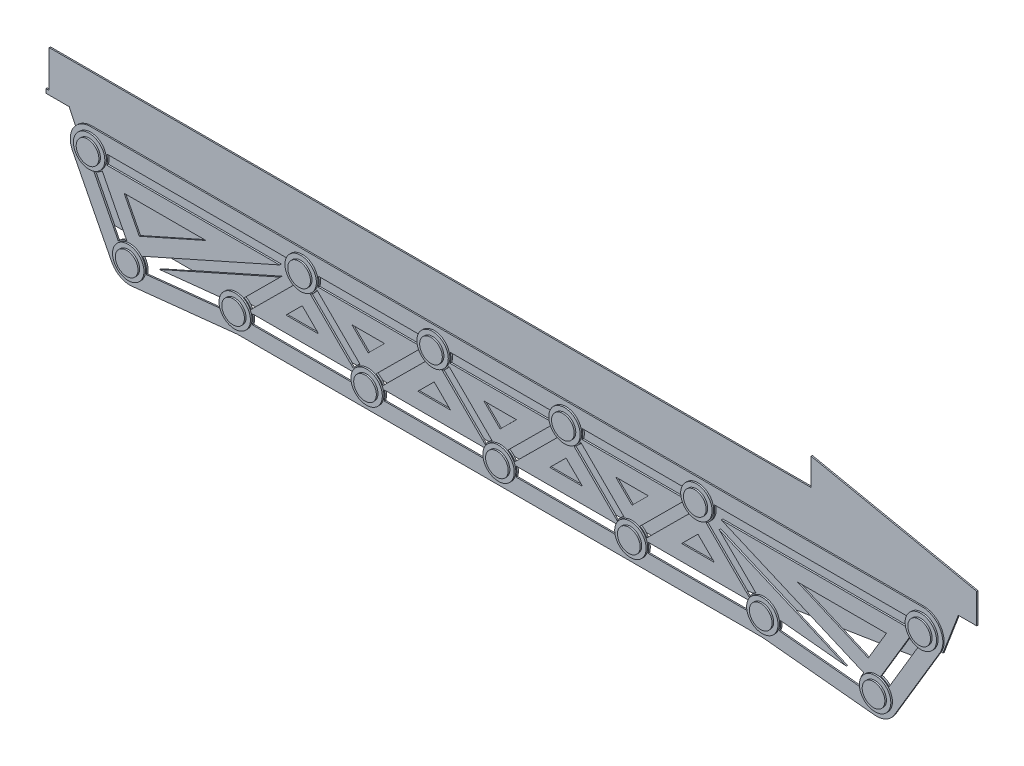
from build123d import *

# Parameters (mm, degrees)
BOSS_EXTRUDE1_DEPTH     = 2
CUT_EXTRUDE1_DEPTH      = 95
BOSS_EXTRUDE2_DEPTH     = 2
SKETCH8_R               = 24.537448368
SKETCH8_R_2             = 17.7
BOSS_EXTRUDE3_DEPTH     = 2.5
SKETCH10_R              = 17.7
BOSS_EXTRUDE4_DEPTH     = 5
CUT_EXTRUDE_THIN1_START = -2.5
CUT_EXTRUDE_THIN1_DEPTH = 2.5
SKETCH13_R              = 26.082644492
BOSS_EXTRUDE7_DEPTH     = 2.5


# Read off the part's stored shape, not the designer's step: Cut-Extrude-Thin1
with BuildPart() as part:
    # Sketch1 → Boss-Extrude1 (new body)
    with BuildSketch(Plane.XY):
        Polygon((-736.648701218, 88.883015108), (453.41882074, 88.883015108), (453.41882074, 173.482456742), (711.95348608, 124.467176144), (711.95348608, 30.993499664), (683.208977835, 30.993499664), (659.264020192, -32.002513419), (641.952563774, -32.002513419), (632.634396759, -56.517377047), (353.590702351, -101.164368152), (-642.977873177, -101.164368152), (-674.853268885, -32.002513419), (-679.263572152, -32.002513419), (-705.332399808, 24.560501137), (-741.648701218, 24.560501137), (-741.648701218, 30.993499664), (-736.648701218, 30.993499664), align=None)
    extrude(amount=BOSS_EXTRUDE1_DEPTH)

    # Sketch4 → Cut-Extrude1 (cut)
    with BuildSketch(Plane.XY.offset(2)):
        Polygon((453.41882074, 131.182735925), (711.95348608, 77.730337904), (711.95348608, 124.467176144), (453.41882074, 173.482456742), align=None)
    extrude(amount=-CUT_EXTRUDE1_DEPTH, mode=Mode.SUBTRACT)

    # Sketch7 → Boss-Extrude2 (add)
    with BuildSketch(Plane.XY.offset(2)):
        with BuildLine():
            Line((-698.284481822, -30.128109135), (-637.164888543, -150.007726386))
            ThreePointArc((-637.164888543, -150.007726386), (-623.935322202, -163.580236507), (-605.344607638, -167.270736277))
            Line((-605.344607638, -167.270736277), (-440.725267433, -149.897212351))
            Line((-440.725267433, -149.897212351), (380.005637956, -149.897212351))
            Line((380.005637956, -149.897212351), (554.595690688, -167.289830618))
            ThreePointArc((554.595690688, -167.289830618), (572.156705191, -164.021740444), (585.219602483, -151.838540615))
            Line((585.219602483, -151.838540615), (656.581665828, -31.958923364))
            ThreePointArc((656.581665828, -31.958923364), (656.903283945, 0.17688449), (629.125222909, 16.338348214))
            Line((629.125222909, 16.338348214), (-669.81781481, 16.338348214))
            ThreePointArc((-669.81781481, 16.338348214), (-697.064295268, 1.077341701), (-698.284481822, -30.128109135))
        make_face()
        Polygon((-617.660623592, -47.5675951), (-594.00016655, -93.975078886), (-489.752744141, -47.5675951), align=None, mode=Mode.SUBTRACT)
        Polygon((-364.907828833, -85.991269037), (-313.905606566, -85.991269037), (-339.4067177, -60.65613368), align=None, mode=Mode.SUBTRACT)
        Polygon((572.91832989, -47.5675951), (433.984814975, -47.5675951), (544.633939386, -95.081943043), align=None, mode=Mode.SUBTRACT)
        Polygon((-236.4067177, -72.902730457), (-210.905606566, -47.5675951), (-261.907828833, -47.5675951), align=None, mode=Mode.SUBTRACT)
        Polygon((-158.907828833, -85.991269037), (-133.4067177, -60.65613368), (-107.905606566, -85.991269037), align=None, mode=Mode.SUBTRACT)
        Polygon((72.5932823, -60.65613368), (98.094393434, -85.991269037), (47.092171167, -85.991269037), align=None, mode=Mode.SUBTRACT)
        Polygon((-55.907828833, -47.5675951), (-30.4067177, -72.902730457), (-4.905606566, -47.5675951), align=None, mode=Mode.SUBTRACT)
        Polygon((201.094393434, -47.5675951), (150.092171167, -47.5675951), (175.5932823, -72.902730457), align=None, mode=Mode.SUBTRACT)
        Polygon((253.092171167, -85.991269037), (278.5932823, -60.65613368), (304.094393434, -85.991269037), align=None, mode=Mode.SUBTRACT)
    extrude(amount=BOSS_EXTRUDE2_DEPTH)

    # Sketch8 → Boss-Extrude3 (add)
    # profile 1 of 13: a face of its own
    with BuildSketch(Plane.XY.offset(4)):
        with Locations((-669.81781481, -15.614623443)):
            Circle(SKETCH8_R)
        with Locations((-669.81781481, -15.614623443)):
            Circle(SKETCH8_R_2, mode=Mode.SUBTRACT)
    # profile 2 of 13: a face of its own
    with BuildSketch(Plane.XY.offset(4)):
        with Locations((-339.4067177, -15.614623443)):
            Circle(SKETCH8_R)
        with Locations((-339.4067177, -15.614623443)):
            Circle(SKETCH8_R_2, mode=Mode.SUBTRACT)
    # profile 3 of 13: a face of its own
    with BuildSketch(Plane.XY.offset(4)):
        with Locations((-133.4067177, -15.614623443)):
            Circle(SKETCH8_R)
        with Locations((-133.4067177, -15.614623443)):
            Circle(SKETCH8_R_2, mode=Mode.SUBTRACT)
    # profile 4 of 13: a face of its own
    with BuildSketch(Plane.XY.offset(4)):
        with Locations((72.5932823, -15.614623443)):
            Circle(SKETCH8_R)
        with Locations((72.5932823, -15.614623443)):
            Circle(SKETCH8_R_2, mode=Mode.SUBTRACT)
    # profile 5 of 13: a face of its own
    with BuildSketch(Plane.XY.offset(4)):
        with Locations((278.5932823, -15.614623443)):
            Circle(SKETCH8_R)
        with Locations((278.5932823, -15.614623443)):
            Circle(SKETCH8_R_2, mode=Mode.SUBTRACT)
    # profile 6 of 13: a face of its own
    with BuildSketch(Plane.XY.offset(4)):
        with Locations((381.5932823, -117.944240694)):
            Circle(SKETCH8_R)
        with Locations((381.5932823, -117.944240694)):
            Circle(SKETCH8_R_2, mode=Mode.SUBTRACT)
    # profile 7 of 13: a face of its own
    with BuildSketch(Plane.XY.offset(4)):
        with Locations((557.763159564, -135.494240694)):
            Circle(SKETCH8_R)
        with Locations((557.763159564, -135.494240694)):
            Circle(SKETCH8_R_2, mode=Mode.SUBTRACT)
    # profile 8 of 13: a face of its own
    with BuildSketch(Plane.XY.offset(4)):
        with Locations((629.125222909, -15.614623443)):
            Circle(SKETCH8_R)
        with Locations((629.125222909, -15.614623443)):
            Circle(SKETCH8_R_2, mode=Mode.SUBTRACT)
    # profile 9 of 13: a face of its own
    with BuildSketch(Plane.XY.offset(4)):
        with Locations((175.5932823, -117.944240694)):
            Circle(SKETCH8_R)
        with Locations((175.5932823, -117.944240694)):
            Circle(SKETCH8_R_2, mode=Mode.SUBTRACT)
    # profile 10 of 13: a face of its own
    with BuildSketch(Plane.XY.offset(4)):
        with Locations((-30.4067177, -117.944240694)):
            Circle(SKETCH8_R)
        with Locations((-30.4067177, -117.944240694)):
            Circle(SKETCH8_R_2, mode=Mode.SUBTRACT)
    # profile 11 of 13: a face of its own
    with BuildSketch(Plane.XY.offset(4)):
        with Locations((-236.4067177, -117.944240694)):
            Circle(SKETCH8_R)
        with Locations((-236.4067177, -117.944240694)):
            Circle(SKETCH8_R_2, mode=Mode.SUBTRACT)
    # profile 12 of 13: a face of its own
    with BuildSketch(Plane.XY.offset(4)):
        with Locations((-442.4067177, -117.944240694)):
            Circle(SKETCH8_R)
        with Locations((-442.4067177, -117.944240694)):
            Circle(SKETCH8_R_2, mode=Mode.SUBTRACT)
    # profile 13 of 13: a face of its own
    with BuildSketch(Plane.XY.offset(4)):
        with Locations((-608.698221531, -135.494240694)):
            Circle(SKETCH8_R)
        with Locations((-608.698221531, -135.494240694)):
            Circle(SKETCH8_R_2, mode=Mode.SUBTRACT)
    extrude(amount=BOSS_EXTRUDE3_DEPTH)

    # Sketch10 → Boss-Extrude4 (add)
    with BuildSketch(Plane.XY.offset(4)):
        with Locations((-669.81781481, -15.614623443)):
            Circle(SKETCH10_R)
        with Locations((-339.4067177, -15.614623443)):
            Circle(SKETCH10_R)
        with Locations((-133.4067177, -15.614623443)):
            Circle(SKETCH10_R)
        with Locations((72.5932823, -15.614623443)):
            Circle(SKETCH10_R)
        with Locations((278.5932823, -15.614623443)):
            Circle(SKETCH10_R)
        with Locations((629.125222909, -15.614623443)):
            Circle(SKETCH10_R)
        with Locations((557.763159564, -135.494240694)):
            Circle(SKETCH10_R)
        with Locations((381.5932823, -117.944240694)):
            Circle(SKETCH10_R)
        with Locations((175.5932823, -117.944240694)):
            Circle(SKETCH10_R)
        with Locations((-30.4067177, -117.944240694)):
            Circle(SKETCH10_R)
        with Locations((-236.4067177, -117.944240694)):
            Circle(SKETCH10_R)
        with Locations((-442.4067177, -117.944240694)):
            Circle(SKETCH10_R)
        with Locations((-608.698221531, -135.494240694)):
            Circle(SKETCH10_R)
    extrude(amount=BOSS_EXTRUDE4_DEPTH)

    # Cut-Extrude-Thin1 outline → Cut-Extrude-Thin1 (cut)
    with BuildSketch(Plane.XY.offset(4).offset(CUT_EXTRUDE_THIN1_START)):
        Polygon((557.763159564, -135.494240694), (564.207734551, -139.330574), (642.318102187, -8.114623443), (75.685549698, -8.114623443), (72.5932823, -5.042482285), (69.501014902, -8.114623443), (-130.314450302, -8.114623443), (-133.4067177, -5.042482285), (-136.498985098, -8.114623443), (-682.060148272, -8.114623443), (-615.379916269, -138.900845371), (-608.698221531, -135.494240694), (-607.911061436, -142.952818238), (-442.012047772, -125.444240694), (381.220630495, -125.444240694), (557.019691419, -142.957300061), align=None)
        Polygon((-605.248294759, -125.748864993), (-657.575481348, -23.114623443), (-374.695929934, -23.114623443), align=None, mode=Mode.SUBTRACT)
        Polygon((-562.32047407, -123.057993764), (-373.659641462, -39.072468482), (-445.819607455, -110.762776258), align=None, mode=Mode.SUBTRACT)
        Polygon((-424.216182161, -110.444240694), (-339.4067177, -26.186764601), (-254.597253238, -110.444240694), align=None, mode=Mode.SUBTRACT)
        Polygon((-236.4067177, -107.372099536), (-321.216182161, -23.114623443), (-151.597253238, -23.114623443), align=None, mode=Mode.SUBTRACT)
        Polygon((-218.216182161, -110.444240694), (-133.4067177, -26.186764601), (-48.597253238, -110.444240694), align=None, mode=Mode.SUBTRACT)
        Polygon((-30.4067177, -107.372099536), (-115.216182161, -23.114623443), (54.402746762, -23.114623443), align=None, mode=Mode.SUBTRACT)
        Polygon((-12.216182161, -110.444240694), (72.5932823, -26.186764601), (157.402746762, -110.444240694), align=None, mode=Mode.SUBTRACT)
        Polygon((175.5932823, -107.372099536), (90.783817839, -23.114623443), (260.402746762, -23.114623443), align=None, mode=Mode.SUBTRACT)
        Polygon((193.783817839, -110.444240694), (278.5932823, -26.186764601), (363.402746762, -110.444240694), align=None, mode=Mode.SUBTRACT)
        Polygon((384.988644031, -110.745362316), (311.805762756, -38.038796974), (510.159704342, -123.214872669), align=None, mode=Mode.SUBTRACT)
        Polygon((554.681469623, -126.008668096), (315.066775519, -23.114623443), (615.932343631, -23.114623443), align=None, mode=Mode.SUBTRACT)
    extrude(amount=CUT_EXTRUDE_THIN1_DEPTH, mode=Mode.SUBTRACT)

    # Sketch13 → Boss-Extrude7 (add)
    with BuildSketch(Plane.XY.offset(1.5)):
        with Locations((-669.81781481, -15.614623443)):
            Circle(SKETCH13_R)
        with Locations((-339.4067177, -15.614623443)):
            Circle(SKETCH13_R)
        with Locations((-133.4067177, -15.614623443)):
            Circle(SKETCH13_R)
        with Locations((72.5932823, -15.614623443)):
            Circle(SKETCH13_R)
        with Locations((278.5932823, -15.614623443)):
            Circle(SKETCH13_R)
        with Locations((629.125222909, -15.614623443)):
            Circle(SKETCH13_R)
        with Locations(Location((557.763159564, -135.494240694, 0), (0, 0, 191.022165453))):
            Circle(SKETCH13_R)
        with Locations((381.5932823, -117.944240694)):
            Circle(SKETCH13_R)
        with Locations((175.5932823, -117.944240694)):
            Circle(SKETCH13_R)
        with Locations((-30.4067177, -117.944240694)):
            Circle(SKETCH13_R)
        with Locations((-236.4067177, -117.944240694)):
            Circle(SKETCH13_R)
        with Locations((-442.4067177, -117.944240694)):
            Circle(SKETCH13_R)
        with Locations(Location((-608.698221531, -135.494240694, 0), (0, 0, 133.725557284))):
            Circle(SKETCH13_R)
    extrude(amount=BOSS_EXTRUDE7_DEPTH)


solid = part.part
